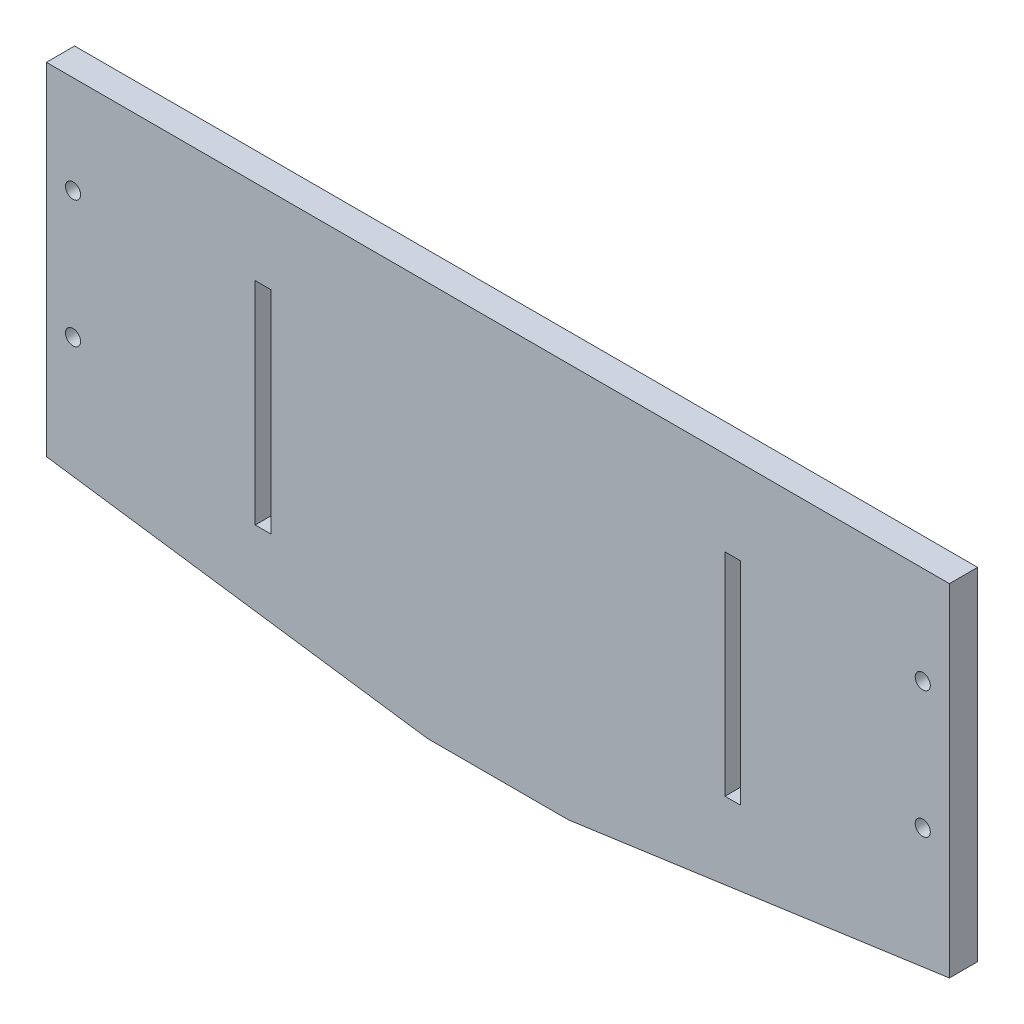
from build123d import *

# Parameters (mm, degrees)
SKETCH1_W            = 203.2
SKETCH1_H            = 127
BOSS_EXTRUDE1_DEPTH  = 6.35
M3_CLEARANCE_HOLE1_D = 3.4
SKETCH4_W            = 3.5052
SKETCH4_H            = 47.625
CUT_EXTRUDE1_DEPTH   = 240.70724332
CUT_EXTRUDE2_DEPTH   = 240.70724332


with BuildPart() as part:
    # Sketch1 → Boss-Extrude1 (new body)
    with BuildSketch(Plane.XY):
        with Locations((101.6, 63.5)):
            Rectangle(SKETCH1_W, SKETCH1_H)
    extrude(amount=BOSS_EXTRUDE1_DEPTH)

    # M3 Clearance Hole1 (through all)
    with Locations(Plane.XY.offset(6.35)):
        with Locations((5.9944, 105.0036), (5.9944, 76.4286), (197.2056, 76.4286), (197.2056, 105.0036)):
            Hole(M3_CLEARANCE_HOLE1_D / 2)

    # Sketch4 → Cut-Extrude1 (cut, through all)
    with BuildSketch(Plane.XY.offset(6.35)):
        with Locations((48.7426, 84.1375)):
            Rectangle(SKETCH4_W, SKETCH4_H)
        with Locations((154.4574, 84.1375)):
            Rectangle(SKETCH4_W, SKETCH4_H)
    extrude(amount=-CUT_EXTRUDE1_DEPTH, mode=Mode.SUBTRACT)

    # Sketch5 → Cut-Extrude2 (cut, through all)
    with BuildSketch(Plane.XY.offset(6.35)):
        Polygon((0, 50.147863055), (85.725, 38.1), (117.475, 38.1), (203.2, 50.147863055), (203.2, 0), (0, 0), align=None)
    extrude(amount=-CUT_EXTRUDE2_DEPTH, mode=Mode.SUBTRACT)


solid = part.part
